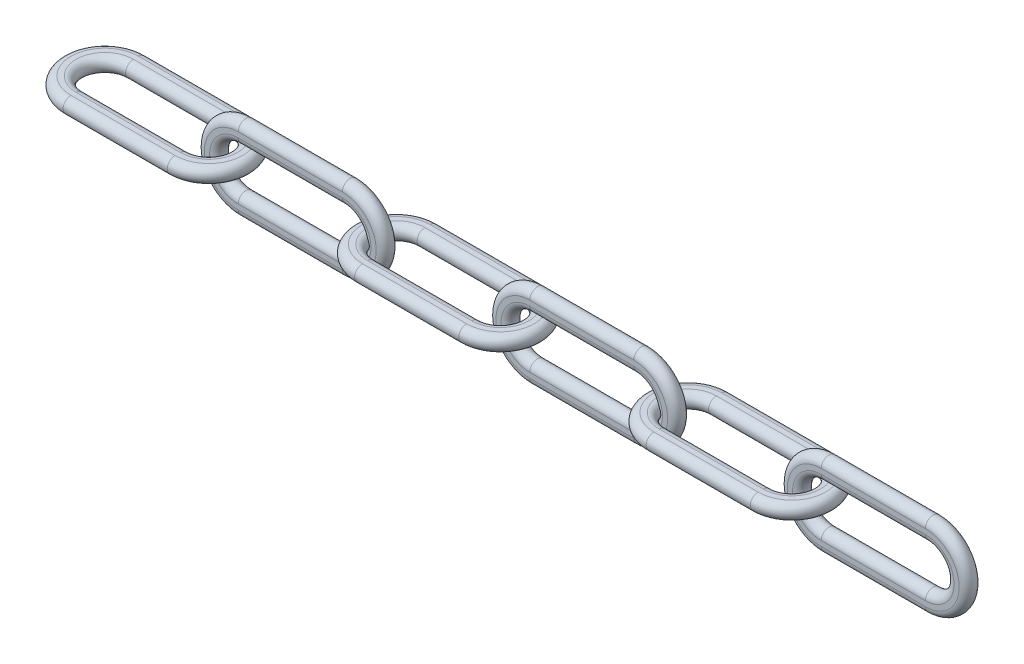
from build123d import *

# Parameters (mm, degrees)
ESTRUSIONE_ESTRUSIONE1_DEPTH = 1.5
RACCORDO9_R                  = 0.75
RACCORDO13_R                 = 0.75
ESTRUSIONE_ESTRUSIONE2_DEPTH = 0.75
RACCORDO16_R                 = 0.75
RACCORDO17_R                 = 0.75
RIPETIZIONE_A_L2_COUNT       = 3
RIPETIZIONE_A_L2_PITCH       = 28
RIPETIZIONE_A_L3_COUNT       = 3
RIPETIZIONE_A_L3_PITCH       = 28


with BuildPart() as part:
    # Schizzo1 → Estrusione-Estrusione1 (new body)
    with BuildSketch(Plane(origin=(0, 0, 0), x_dir=(1, 0, 0), z_dir=(0, 1, 0))):
        with BuildLine():
            Line((-7.06089646, 4), (2.93910354, 4))
            ThreePointArc((2.93910354, 4), (6.93910354, 0), (2.93910354, -4))
            Line((2.93910354, -4), (-7.06089646, -4))
            ThreePointArc((-7.06089646, -4), (-11.06089646, 0), (-7.06089646, 4))
        make_face()
        with BuildLine():
            Line((-7.06089646, 2), (2.93910354, 2))
            ThreePointArc((2.93910354, 2), (4.93910354, 0), (2.93910354, -2))
            Line((2.93910354, -2), (-7.06089646, -2))
            ThreePointArc((-7.06089646, -2), (-9.06089646, 0), (-7.06089646, 2))
        make_face(mode=Mode.SUBTRACT)
    extrude(amount=ESTRUSIONE_ESTRUSIONE1_DEPTH)

    # Raccordo9
    raccordo9_edges = [part.edges().sort_by_distance(p)[0] for p in [
        (6.93910354, 1.5, 0),
        (-2.06089646, 1.5, -4),
        (-11.06089646, 1.5, 0),
        (-2.06089646, 0, -4),
        (-2.06089646, 0, 4),
        (-2.06089646, 1.5, 4),
    ]]
    fillet(raccordo9_edges, radius=RACCORDO9_R - 0.0001)  # a hair under: the kernel refuses the full size

    # Raccordo13
    raccordo13_edges = [part.edges().sort_by_distance(p)[0] for p in [
        (-9.06089646, 0, 0),
        (-2.06089646, 0, 2),
        (4.93910354, 0, 0),
        (-2.06089646, 0, -2),
        (-2.06089646, 1.5, 2),
        (-2.06089646, 1.5, -2),
    ]]
    fillet(raccordo13_edges, radius=RACCORDO13_R - 0.0001)  # a hair under: the kernel refuses the full size


with BuildPart() as body_2:
    # Schizzo3 → Estrusione-Estrusione2 (new, symmetric)
    with BuildSketch(Plane.XY):
        with BuildLine():
            Line((6.5070567, 4.75), (16.5070567, 4.75))
            ThreePointArc((16.5070567, 4.75), (20.5070567, 0.75), (16.5070567, -3.25))
            Line((16.5070567, -3.25), (6.5070567, -3.25))
            ThreePointArc((6.5070567, -3.25), (2.5070567, 0.75), (6.5070567, 4.75))
        make_face()
        with BuildLine():
            Line((6.5070567, 2.75), (16.5070567, 2.75))
            ThreePointArc((16.5070567, 2.75), (18.5070567, 0.75), (16.5070567, -1.25))
            Line((16.5070567, -1.25), (6.5070567, -1.25))
            ThreePointArc((6.5070567, -1.25), (4.5070567, 0.75), (6.5070567, 2.75))
        make_face(mode=Mode.SUBTRACT)
    extrude(amount=ESTRUSIONE_ESTRUSIONE2_DEPTH, both=True)

    # Raccordo16
    raccordo16_edges = [body_2.edges().sort_by_distance(p)[0] for p in [
        (20.5070567, 0.75, 0.75),
        (11.5070567, 4.75, 0.75),
        (2.5070567, 0.75, 0.75),
        (11.5070567, 4.75, -0.75),
        (11.5070567, -3.25, -0.75),
        (11.5070567, -3.25, 0.75),
    ]]
    fillet(raccordo16_edges, radius=RACCORDO16_R - 0.0001)  # a hair under: the kernel refuses the full size

    # Raccordo17
    raccordo17_edges = [body_2.edges().sort_by_distance(p)[0] for p in [
        (4.5070567, 0.75, -0.75),
        (11.5070567, -1.25, -0.75),
        (18.5070567, 0.75, -0.75),
        (11.5070567, 2.75, -0.75),
        (11.5070567, -1.25, 0.75),
        (11.5070567, 2.75, 0.75),
    ]]
    fillet(raccordo17_edges, radius=RACCORDO17_R - 0.0001)  # a hair under: the kernel refuses the full size


with BuildPart() as ripetizione_a_l2_1:
    # Ripetizione a L2: pattern copy
    add(part.part.moved(Location(Vector(1, 0, 0) * (1 * RIPETIZIONE_A_L2_PITCH))))


with BuildPart() as ripetizione_a_l2_2:
    # Ripetizione a L2: pattern copy
    add(part.part.moved(Location(Vector(1, 0, 0) * (2 * RIPETIZIONE_A_L2_PITCH))))


with BuildPart() as ripetizione_a_l3_1:
    # Ripetizione a L3: pattern copy
    add(body_2.part.moved(Location(Vector(1, 0, 0) * (1 * RIPETIZIONE_A_L3_PITCH))))


with BuildPart() as ripetizione_a_l3_2:
    # Ripetizione a L3: pattern copy
    add(body_2.part.moved(Location(Vector(1, 0, 0) * (2 * RIPETIZIONE_A_L3_PITCH))))


solid = Compound([part.part, body_2.part, ripetizione_a_l2_1.part, ripetizione_a_l2_2.part, ripetizione_a_l3_1.part, ripetizione_a_l3_2.part])
